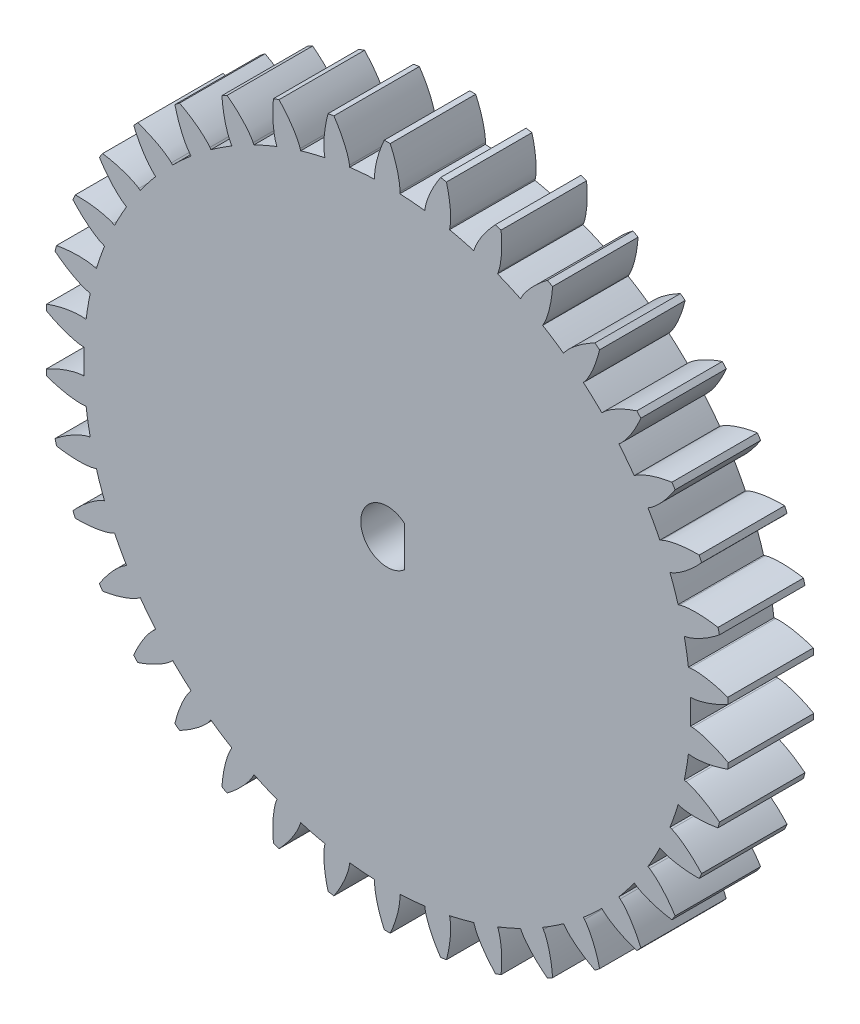
from build123d import *

# Parameters (mm, degrees)
SKETCH_1_R                       = 5
SKETCH_1_R_2                     = 1.5
EXTRUDE_1_DEPTH                  = 5
CUT_EXTRUDE_1_DEPTH              = 9.660254038
FILLET_1_R                       = 0.5
PATTERN_CIRCULAR_1_COUNT         = 8
PATTERN_CIRCULAR_1_ANGLE         = 315
FILLET_1_OF_PATTERN_CIRCULAR_1_R = 0.5
SKETCH_2_R                       = 20
SKETCH_2_R_2                     = 1.5
EXTRUDE_2_DEPTH                  = 5
CUT_EXTRUDE_3_DEPTH              = 29.722813389
PATTERN_CIRCULAR_2_COUNT         = 38
SKETCH_3_R                       = 1.55
EXTRUDE_3_DEPTH                  = 10
CUT_EXTRUDE_4_DEPTH              = 30.963536777
SKETCH_4_R                       = 10
CUT_EXTRUDE_5_DEPTH              = 29.684726514


with BuildPart() as part:
    # 草图1 → 凸台-拉伸1 (new body)
    with BuildSketch(Plane.XY):
        Circle(SKETCH_1_R)
        Circle(SKETCH_1_R_2, mode=Mode.SUBTRACT)
    extrude(amount=EXTRUDE_1_DEPTH)

    # 草图1<3> → 切除-拉伸1 (cut, through all)
    with BuildSketch(Plane.XY):
        with BuildLine():
            Line((3.694052861, 0.694499102), (2.70265115, 0.508110974))
            ThreePointArc((2.70265115, 0.508110974), (2.738137201, 0.255156165), (2.75, 0))
            ThreePointArc((2.75, 0), (2.738137201, -0.255156165), (2.70265115, -0.508110974))
            Line((2.70265115, -0.508110974), (3.694052861, -0.694499102))
            add(Edge.make_bspline(
                [(3.694052861, -0.694499102), (3.722211627, -0.699793081), (3.799693178, -0.720419243), (3.940318318, -0.782609443), (4.152220935, -0.913709849), (4.396753171, -1.123866204), (4.57470903, -1.327029126), (4.691039069, -1.485797488), (4.747245846, -1.569604051)],
                knots=[0, 0, 0, 0, 0, 0.005604068, 0.015718248, 0.029959916, 0.048733667, 0.068515916, 0.068515916, 0.068515916, 0.068515916, 0.068515916], degree=4))
            ThreePointArc((4.747245846, -1.569604051), (4.936407055, -0.794912187), (5, 0))
            ThreePointArc((5, 0), (4.936407055, 0.794912187), (4.747245846, 1.569604051))
            add(Edge.make_bspline(
                [(3.694052861, 0.694499102), (3.722211627, 0.699793081), (3.799693178, 0.720419243), (3.940318318, 0.782609443), (4.152220935, 0.913709849), (4.396753171, 1.123866204), (4.57470903, 1.327029126), (4.691039069, 1.485797488), (4.747245846, 1.569604051)],
                knots=[0, 0, 0, 0, 0, 0.005604068, 0.015718248, 0.029959916, 0.048733667, 0.068515916, 0.068515916, 0.068515916, 0.068515916, 0.068515916], degree=4))
        make_face()
    cut_extrude_1 = extrude(amount=CUT_EXTRUDE_1_DEPTH, mode=Mode.SUBTRACT)

    # 圆角1
    fillet_1_edges = [part.edges().sort_by_distance(p)[0] for p in [
        (2.70265115, -0.508110974, 2.5),
        (4.747245846, -1.569604051, 2.5),
        (4.747245846, 1.569604051, 2.5),
        (2.70265115, 0.508110974, 2.5),
    ]]
    fillet(fillet_1_edges, radius=FILLET_1_R)

    # 阵列(圆周)1: 切除-拉伸1 ×8 about axis
    pattern_circular_1_axis = Axis((0, 0, 5), (0, 0, 1))
    for i in range(1, PATTERN_CIRCULAR_1_COUNT):
        add(cut_extrude_1.rotate(pattern_circular_1_axis, i * PATTERN_CIRCULAR_1_ANGLE / (PATTERN_CIRCULAR_1_COUNT - 1)), mode=Mode.SUBTRACT)

    # 圆角1 of 阵列(圆周)1
    fillet_1_of_pattern_circular_1_edges = [part.edges().sort_by_distance(p)[0] for p in [
        (2.27035167, 1.55177424, 2.5),
        (4.466687398, 2.246932061, 2.5),
        (2.246932061, 4.466687398, 2.5),
        (1.55177424, 2.27035167, 2.5),
        (0.508110974, 2.70265115, 2.5),
        (1.569604051, 4.747245846, 2.5),
        (-1.569604051, 4.747245846, 2.5),
        (-0.508110974, 2.70265115, 2.5),
        (-1.55177424, 2.27035167, 2.5),
        (-2.246932061, 4.466687398, 2.5),
        (-4.466687398, 2.246932061, 2.5),
        (-2.27035167, 1.55177424, 2.5),
        (-2.70265115, 0.508110974, 2.5),
        (-4.747245846, 1.569604051, 2.5),
        (-4.747245846, -1.569604051, 2.5),
        (-2.70265115, -0.508110974, 2.5),
        (-2.27035167, -1.55177424, 2.5),
        (-4.466687398, -2.246932061, 2.5),
        (-2.246932061, -4.466687398, 2.5),
        (-1.55177424, -2.27035167, 2.5),
        (-0.508110974, -2.70265115, 2.5),
        (-1.569604051, -4.747245846, 2.5),
        (1.569604051, -4.747245846, 2.5),
        (0.508110974, -2.70265115, 2.5),
        (1.55177424, -2.27035167, 2.5),
        (2.246932061, -4.466687398, 2.5),
        (4.466687398, -2.246932061, 2.5),
        (2.27035167, -1.55177424, 2.5),
    ]]
    fillet(fillet_1_of_pattern_circular_1_edges, radius=FILLET_1_OF_PATTERN_CIRCULAR_1_R)

    # 草图2 → 凸台-拉伸2 (add)
    with BuildSketch(Plane.XY.offset(5)):
        Circle(SKETCH_2_R)
        Circle(SKETCH_2_R_2, mode=Mode.SUBTRACT)
    extrude(amount=EXTRUDE_2_DEPTH)

    # 草图2<3> → 切除-拉伸3 (cut, through all)
    with BuildSketch(Plane.XY.offset(5)):
        with BuildLine():
            Line((17.838908029, 0.737822694), (17.734837211, 0.733518293))
            ThreePointArc((17.734837211, 0.733518293), (17.746208898, 0.366837497), (17.75, 0))
            ThreePointArc((17.75, 0), (17.746208898, -0.366837497), (17.734837211, -0.733518293))
            Line((17.734837211, -0.733518293), (17.838908029, -0.737822694))
            add(Edge.make_bspline(
                [(17.838908029, -0.737822694), (17.872849269, -0.739226514), (17.940552494, -0.744118754), (18.075241986, -0.762138409), (18.328810536, -0.812273342), (18.66347973, -0.90508771), (19.120548858, -1.070237387), (19.508851941, -1.247313895), (19.778857482, -1.386865325), (19.937601681, -1.474433608), (19.945263252, -1.478672992)],
                knots=[0, 0, 0, 0, 0, 0.001401017, 0.002802034, 0.005604068, 0.010661158, 0.015718248, 0.022839082, 0.023200461, 0.023200461, 0.023200461, 0.023200461, 0.023200461], degree=4))
            ThreePointArc((19.945263252, -1.478672992), (19.986311128, -0.739842877), (20, 0))
            ThreePointArc((20, 0), (19.986311128, 0.739842877), (19.945263252, 1.478672992))
            add(Edge.make_bspline(
                [(17.838908029, 0.737822694), (17.872849269, 0.739226514), (17.940552494, 0.744118754), (18.075241986, 0.762138409), (18.328810536, 0.812273342), (18.66347973, 0.90508771), (19.120548858, 1.070237387), (19.508851941, 1.247313895), (19.778857482, 1.386865325), (19.937601681, 1.474433608), (19.945263252, 1.478672992)],
                knots=[0, 0, 0, 0, 0, 0.001401017, 0.002802034, 0.005604068, 0.010661158, 0.015718248, 0.022839082, 0.023200461, 0.023200461, 0.023200461, 0.023200461, 0.023200461], degree=4))
        make_face()
    cut_extrude_3 = extrude(amount=CUT_EXTRUDE_3_DEPTH, mode=Mode.SUBTRACT)

    # 阵列(圆周)2: 切除-拉伸3 ×38 about axis
    pattern_circular_2_axis = Axis((0, 0, 10), (0, 0, 1))
    for i in range(1, PATTERN_CIRCULAR_2_COUNT):
        add(cut_extrude_3.rotate(pattern_circular_2_axis, i * 360 / PATTERN_CIRCULAR_2_COUNT), mode=Mode.SUBTRACT)

    # 草图3 → 凸台-拉伸3 (add, through all)
    with BuildSketch(Plane(origin=(0, 0, 0), x_dir=(-1, 0, 0), z_dir=(0, 0, -1))):
        Circle(SKETCH_3_R)
    extrude(amount=-EXTRUDE_3_DEPTH)

    # 草图3<3> → 切除-拉伸4 (cut, through all)
    with BuildSketch(Plane(origin=(0, 0, 0), x_dir=(-1, 0, 0), z_dir=(0, 0, -1))):
        with BuildLine():
            Line((-1, 1.184271928), (-1, -1.184271928))
            ThreePointArc((-1, -1.184271928), (0.652878243, -1.405791592), (1.55, 0))
            ThreePointArc((1.55, 0), (0.652878243, 1.405791592), (-1, 1.184271928))
        make_face()
    extrude(amount=-CUT_EXTRUDE_4_DEPTH, mode=Mode.SUBTRACT)

    # 草图4 → 切除-拉伸5 (cut, through all)
    with BuildSketch(Plane(origin=(0, 0, 5), x_dir=(-1, 0, 0), z_dir=(0, 0, -1))):
        Circle(SKETCH_4_R)
    extrude(amount=CUT_EXTRUDE_5_DEPTH, mode=Mode.SUBTRACT)


solid = part.part
